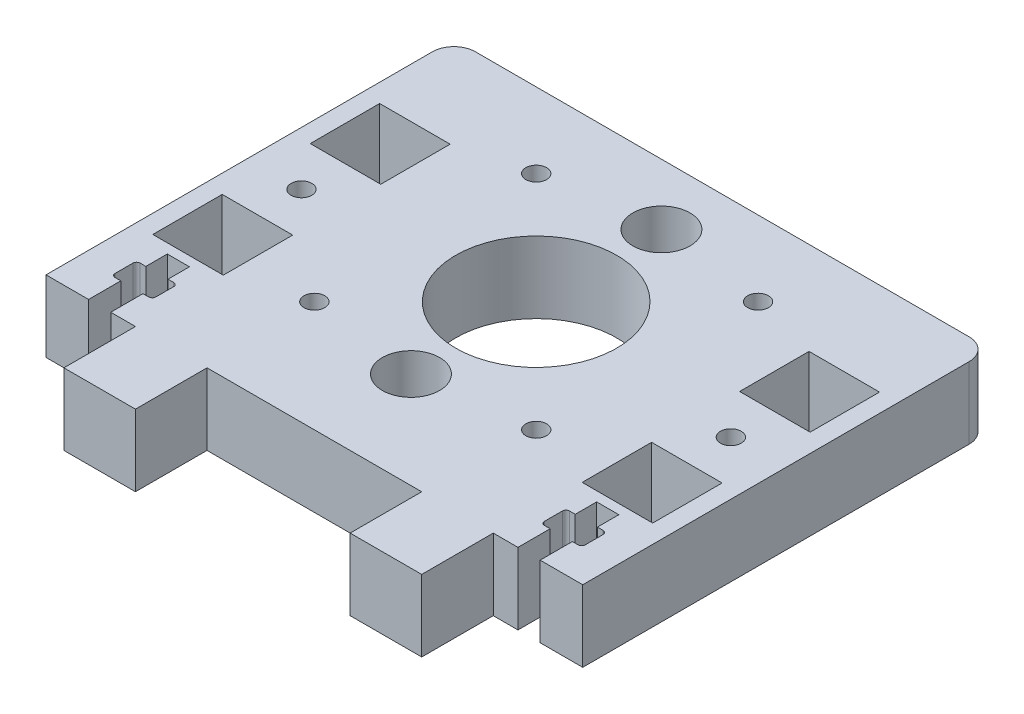
from build123d import *

# Parameters (mm, degrees)
SKETCH1_R          = 1.45
SKETCH1_W          = 9.85
SKETCH1_H          = 9.7
MAINLAYOUT_DEPTH   = 10
TSLOT_DEPTH        = 53.936282454
SKETCH3_R          = 4
CUT_EXTRUDE1_DEPTH = 53.936282454


with BuildPart() as part:
    # Sketch1 → MainLayout (new body)
    with BuildSketch(Plane(origin=(0, 0, 0), x_dir=(1, 0, 0), z_dir=(0, 1, 0))):
        with BuildLine():
            Line((-34.5, 31), (0, 31))
            Line((0, 31), (0, 16.25))
            ThreePointArc((0, 16.25), (-11.25, 5), (0, -6.25))
            Line((0, -6.25), (0, -8.5))
            ThreePointArc((0, -8.5), (-4, -12.5), (0, -16.5))
            Line((0, -16.5), (0, -26))
            Line((0, -26), (-15, -26))
            Line((-15, -26), (-15, -36))
            Line((-15, -36), (-25, -36))
            Line((-25, -36), (-25, -26))
            Line((-25, -26), (-37.5, -26))
            Line((-37.5, -26), (-37.5, 28))
            ThreePointArc((-37.5, 28), (-36.621320344, 30.121320344), (-34.5, 31))
        make_face()
        with Locations((-15.5, 20.5)):
            Circle(SKETCH1_R, mode=Mode.SUBTRACT)
        with Locations((-15.5, -10.5)):
            Circle(SKETCH1_R, mode=Mode.SUBTRACT)
        with Locations((-30, 2.2)):
            Circle(SKETCH1_R, mode=Mode.SUBTRACT)
        with Locations((-30, 13.2)):
            Rectangle(SKETCH1_W, SKETCH1_H, mode=Mode.SUBTRACT)
        with Locations((-30, -8.8)):
            Rectangle(SKETCH1_W, SKETCH1_H, mode=Mode.SUBTRACT)
    mainlayout = extrude(amount=MAINLAYOUT_DEPTH)

    # Sketch2 → TSlot (cut, through all)
    with BuildSketch(Plane(origin=(0, 10, 0), x_dir=(1, 0, 0), z_dir=(0, 1, 0))):
        with BuildLine():
            Line((-28.45, -21.5), (-28.45, -26))
            Line((-28.45, -26), (-31.55, -26))
            Line((-31.55, -26), (-31.55, -21.5))
            Line((-31.55, -21.5), (-32.35, -21.5))
            ThreePointArc((-32.35, -21.5), (-32.703553391, -21.353553391), (-32.85, -21))
            Line((-32.85, -21), (-32.85, -18.5))
            ThreePointArc((-32.85, -18.5), (-32.703553391, -18.146446609), (-32.35, -18))
            Line((-32.35, -18), (-31.55, -18))
            Line((-31.55, -18), (-31.55, -15))
            Line((-31.55, -15), (-28.45, -15))
            Line((-28.45, -15), (-28.45, -18))
            Line((-28.45, -18), (-27.65, -18))
            ThreePointArc((-27.65, -18), (-27.296446609, -18.146446609), (-27.15, -18.5))
            Line((-27.15, -18.5), (-27.15, -21))
            ThreePointArc((-27.15, -21), (-27.296446609, -21.353553391), (-27.65, -21.5))
            Line((-27.65, -21.5), (-28.45, -21.5))
        make_face()
    tslot = extrude(amount=-TSLOT_DEPTH, mode=Mode.SUBTRACT)

    # Mirror1: MainLayout, TSlot across plane
    add(mainlayout.mirror(Plane(origin=(0, 0, 0), x_dir=(0, 0, 1), z_dir=(1, 0, 0))))
    add(tslot.mirror(Plane(origin=(0, 0, 0), x_dir=(0, 0, 1), z_dir=(1, 0, 0))), mode=Mode.SUBTRACT)

    # Sketch3 → Cut-Extrude1 (cut, through all)
    with BuildSketch(Plane(origin=(0, 10, 0), x_dir=(1, 0, 0), z_dir=(0, 1, 0))):
        with Locations((0, 22.5)):
            Circle(SKETCH3_R)
    extrude(amount=-CUT_EXTRUDE1_DEPTH, mode=Mode.SUBTRACT)


solid = part.part
